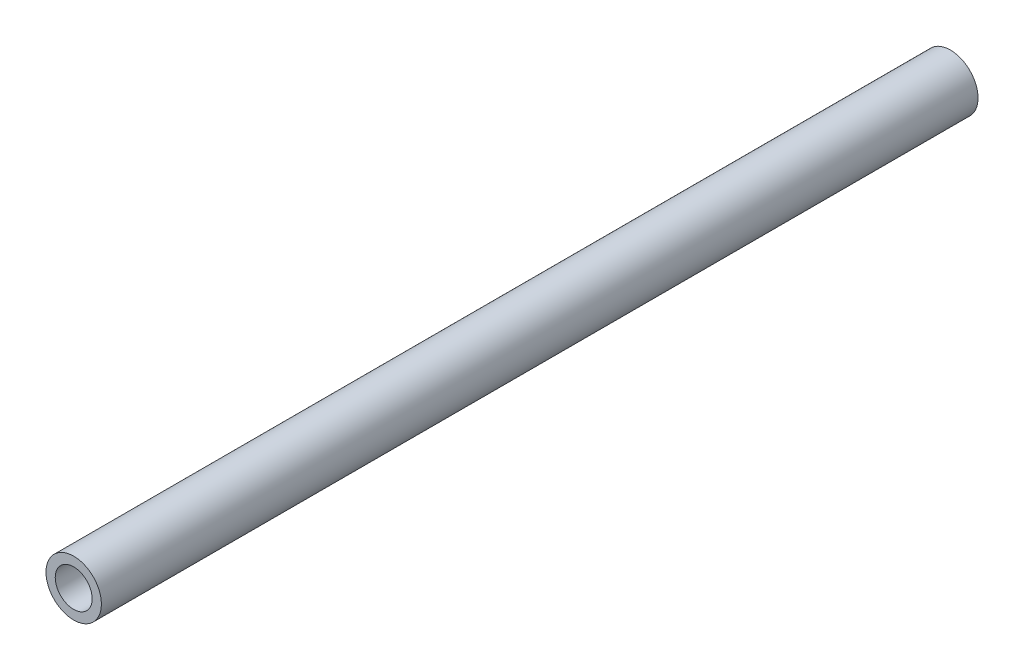
from build123d import *

# Parameters (mm, degrees)
POLE_CROSS_SECTION_SKETCH_R   = 30
POLE_CROSS_SECTION_SKETCH_R_2 = 20
PIPE_EXTRUDE_DEPTH            = 950


with BuildPart() as part:
    # Pole Cross Section Sketch → Pipe Extrude (new body)
    with BuildSketch(Plane.XY):
        Circle(POLE_CROSS_SECTION_SKETCH_R)
        Circle(POLE_CROSS_SECTION_SKETCH_R_2, mode=Mode.SUBTRACT)
    extrude(amount=PIPE_EXTRUDE_DEPTH)


solid = part.part
